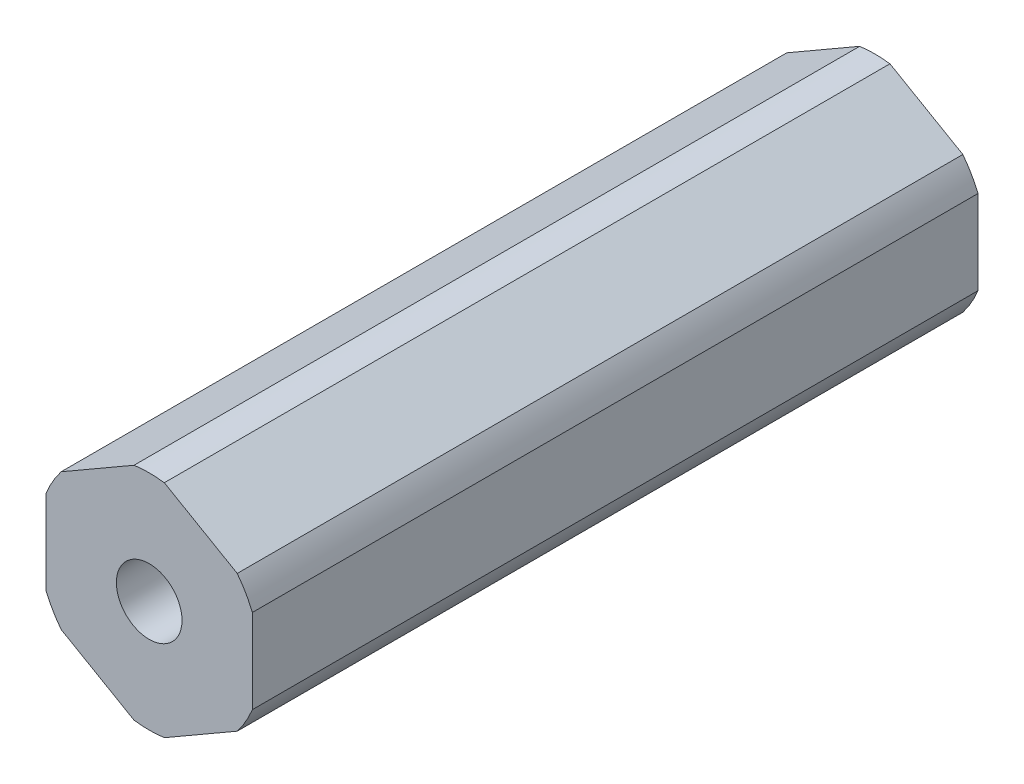
from build123d import *

# Parameters (mm, degrees)
BOSS_EXTRUDE1_DEPTH                  = 22.3266
F_10_32_TAPPED_HOLE2_D               = 4.0386
F_10_32_TAPPED_HOLE2_DEPTH           = 12.02944
F_10_32_TAPPED_HOLE2_TIP             = 1.213317848
F_10_32_TAPPED_HOLE2_ON_FACE_2_D     = 4.0386
F_10_32_TAPPED_HOLE2_ON_FACE_2_DEPTH = 12.02944
F_10_32_TAPPED_HOLE2_ON_FACE_2_TIP   = 1.213317848


with BuildPart() as part:
    # Sketch1 → Boss-Extrude1 (new, symmetric)
    with BuildSketch(Plane.XY):
        with BuildLine():
            ThreePointArc((0.93173274, 6.79441227), (0, 6.858), (-0.93173274, 6.79441227))
            Line((-0.93173274, 6.79441227), (-5.41826726, 4.204110358))
            ThreePointArc((-5.41826726, 4.204110358), (-5.939202219, 3.429), (-6.35, 2.590301913))
            Line((-6.35, 2.590301913), (-6.35, -2.590301913))
            ThreePointArc((-6.35, -2.590301913), (-5.939202219, -3.429), (-5.41826726, -4.204110358))
            Line((-5.41826726, -4.204110358), (-0.93173274, -6.79441227))
            ThreePointArc((-0.93173274, -6.79441227), (0, -6.858), (0.93173274, -6.79441227))
            Line((0.93173274, -6.79441227), (5.41826726, -4.204110358))
            ThreePointArc((5.41826726, -4.204110358), (5.939202219, -3.429), (6.35, -2.590301913))
            Line((6.35, -2.590301913), (6.35, 2.590301913))
            ThreePointArc((6.35, 2.590301913), (5.939202219, 3.429), (5.41826726, 4.204110358))
            Line((5.41826726, 4.204110358), (0.93173274, 6.79441227))
        make_face()
    extrude(amount=BOSS_EXTRUDE1_DEPTH, both=True)

    # #10-32 Tapped Hole2
    with Locations(Plane(origin=(0, 0, -22.3266), x_dir=(-1, 0, 0), z_dir=(0, 0, -1))):
        with Locations((0, 0)):
            Hole(F_10_32_TAPPED_HOLE2_D / 2, depth=F_10_32_TAPPED_HOLE2_DEPTH)
            with Locations((0, 0, -(F_10_32_TAPPED_HOLE2_DEPTH + F_10_32_TAPPED_HOLE2_TIP / 2))):  # 118° drill point
                Cone(0, F_10_32_TAPPED_HOLE2_D / 2, F_10_32_TAPPED_HOLE2_TIP, mode=Mode.SUBTRACT)

    # #10-32 Tapped Hole2 on face 2
    with Locations(Plane.XY.offset(22.3266)):
        with Locations((0, 0)):
            Hole(F_10_32_TAPPED_HOLE2_ON_FACE_2_D / 2, depth=F_10_32_TAPPED_HOLE2_ON_FACE_2_DEPTH)
            with Locations((0, 0, -(F_10_32_TAPPED_HOLE2_ON_FACE_2_DEPTH + F_10_32_TAPPED_HOLE2_ON_FACE_2_TIP / 2))):  # 118° drill point
                Cone(0, F_10_32_TAPPED_HOLE2_ON_FACE_2_D / 2, F_10_32_TAPPED_HOLE2_ON_FACE_2_TIP, mode=Mode.SUBTRACT)


solid = part.part
